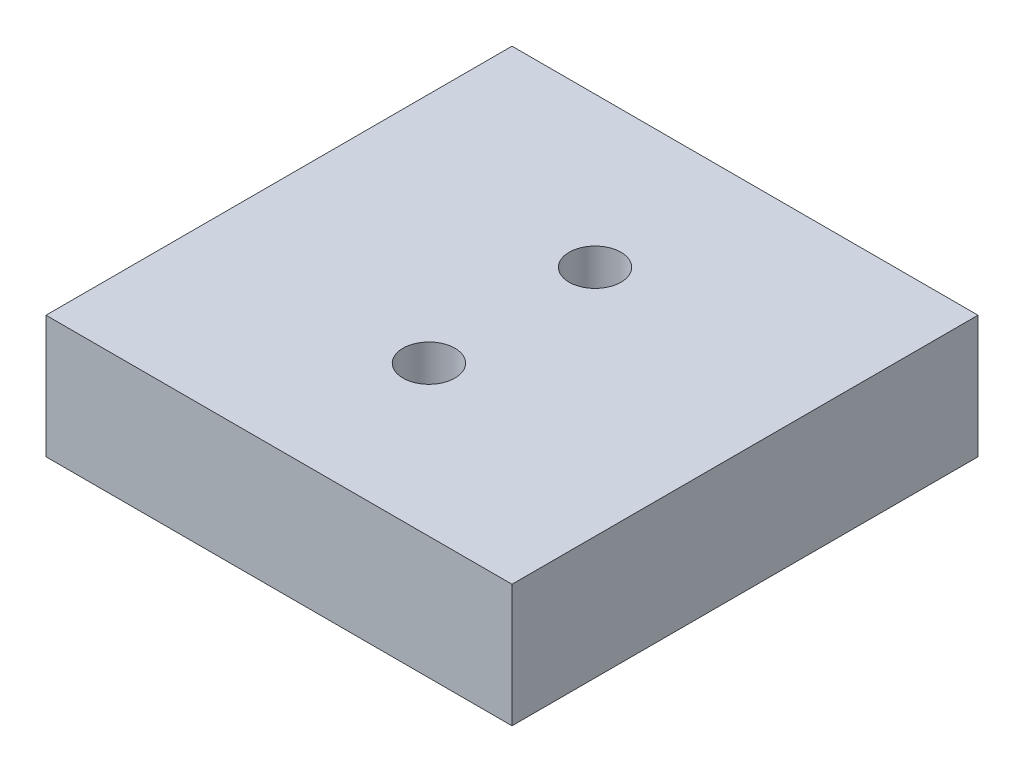
from build123d import *

# Parameters (mm, degrees)
SKETCH1_W           = 57
SKETCH1_H           = 57
BOSS_EXTRUDE1_DEPTH = 15
SKETCH2_R           = 3.175
CUT_EXTRUDE1_DEPTH  = 44.00581356


with BuildPart() as part:
    # Sketch1 → Boss-Extrude1 (new body)
    with BuildSketch(Plane(origin=(0, 0, 0), x_dir=(1, 0, 0), z_dir=(0, 1, 0))):
        Rectangle(SKETCH1_W, SKETCH1_H)
    extrude(amount=BOSS_EXTRUDE1_DEPTH)

    # Sketch2 → Cut-Extrude1 (cut, through all)
    with BuildSketch(Plane(origin=(0, 15, 0), x_dir=(1, 0, 0), z_dir=(0, 1, 0))):
        with Locations((0, 10.16)):
            Circle(SKETCH2_R)
        with Locations((0, -10.16)):
            Circle(SKETCH2_R)
    extrude(amount=-CUT_EXTRUDE1_DEPTH, mode=Mode.SUBTRACT)


solid = part.part
